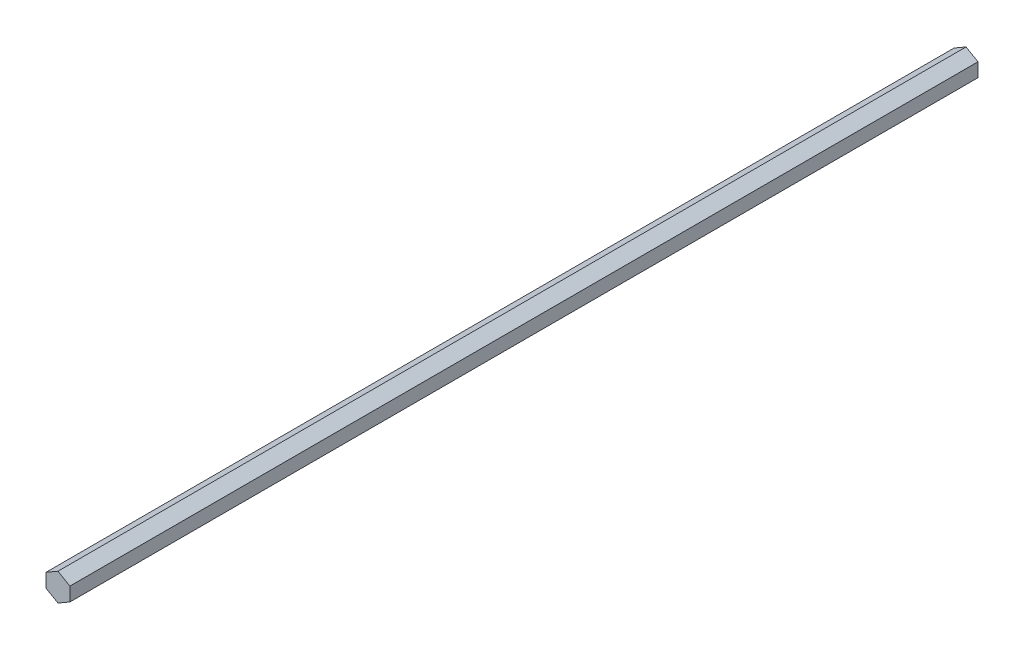
from build123d import *

# Parameters (mm, degrees)
BOSS_EXTRUDE1_DEPTH = 241.3


with BuildPart() as part:
    # Sketch3 → Boss-Extrude1 (new, symmetric)
    with BuildSketch(Plane.XY):
        Polygon((0, 7.332348419), (6.35, 3.666174209), (6.35, -3.666174209), (0, -7.332348419), (-6.35, -3.666174209), (-6.35, 3.666174209), align=None)
    extrude(amount=BOSS_EXTRUDE1_DEPTH, both=True)


solid = part.part
